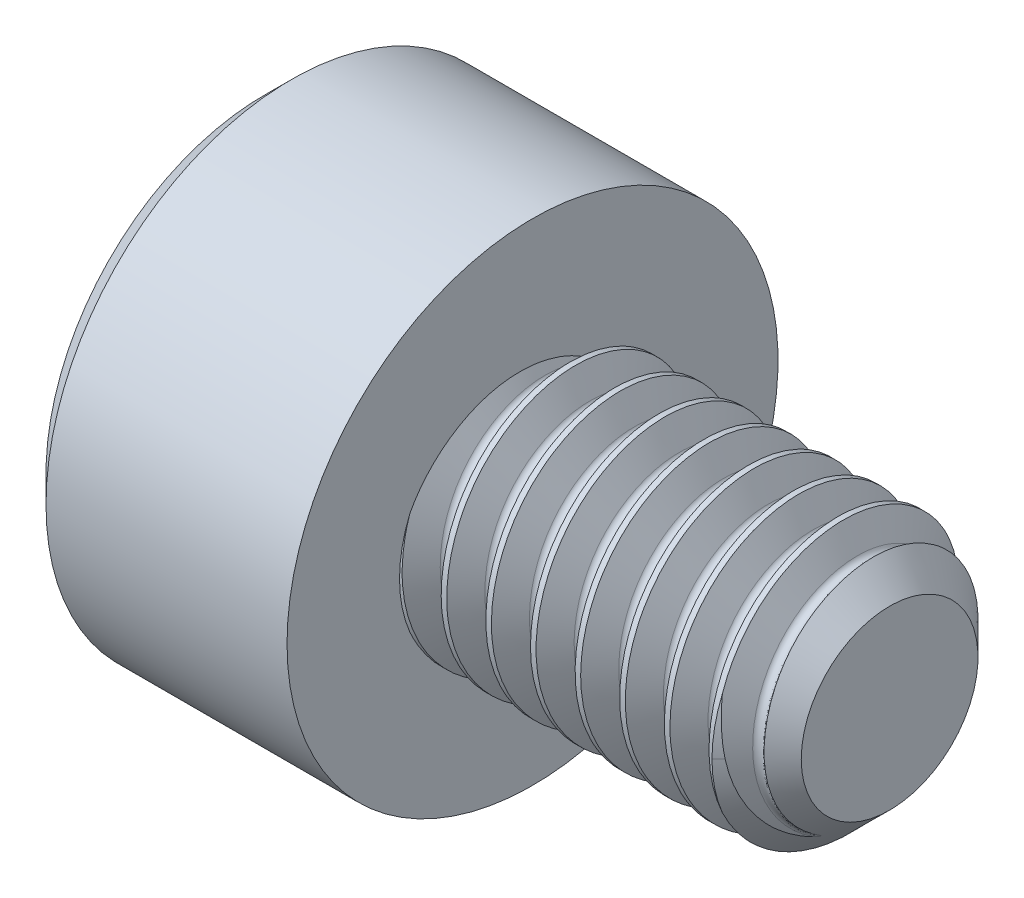
from build123d import *

# Parameters (mm, degrees)
CHAMFER1_SIZE      = 0.5
CHAMFER2_SIZE      = 0.3
CUT_EXTRUDE1_DEPTH = 2.5
CHAMFER3_SIZE      = 0.3
CUT_SWEEP1_PITCH   = 0.5
CUT_SWEEP1_TO      = 4


with BuildPart() as part:
    # Sketch1 → Revolve1 (revolve)
    with BuildSketch(Plane.XY, mode=Mode.PRIVATE) as revolve1_sk:
        Polygon((0, 0), (0, 2.75), (3, 2.75), (3, 1.49), (7, 1.49), (7, 0), align=None)
    revolve(revolve1_sk.sketch.rotate(Axis((-88.705490849, 0, 0), (1, 0, 0)), 90), axis=Axis((-88.705490849, 0, 0), (1, 0, 0)))

    # Chamfer1
    chamfer1_edges = [part.edges().sort_by_distance(p)[0] for p in [
        (7, 0, -1.49),
    ]]
    chamfer(chamfer1_edges, length=CHAMFER1_SIZE)

    # Chamfer2
    chamfer2_edges = [part.edges().sort_by_distance(p)[0] for p in [
        (0, 0, -2.75),
    ]]
    chamfer(chamfer2_edges, length=CHAMFER2_SIZE)

    # Sketch3 → Cut-Extrude1 (cut)
    with BuildSketch(Plane(origin=(0, 0, 0), x_dir=(0, 0, -1), z_dir=(1, 0, 0))):
        Polygon((-1.443375673, 0), (-0.721687836, -1.25), (0.721687836, -1.25), (1.443375673, 0), (0.721687836, 1.25), (-0.721687836, 1.25), align=None)
    extrude(amount=CUT_EXTRUDE1_DEPTH, mode=Mode.SUBTRACT)

    # Chamfer3
    chamfer3_edges = [part.edges().sort_by_distance(p)[0] for p in [
        (0, 0.625, 1.082531755),
        (0, -0.625, 1.082531755),
        (0, -1.25, 0),
        (0, -0.625, -1.082531755),
        (0, 0.625, -1.082531755),
        (0, 1.25, 0),
    ]]
    chamfer(chamfer3_edges, length=CHAMFER3_SIZE)

    # Cut-Sweep1: arcs per turn and ends read off the stored shape
    # Cut-Sweep1: the profile of Sketch8 screwed along a right-hand helix through 9 turns, 6 arcs to a turn; built about Z, then put on its axis
    cut_sweep1_z = Axis((0, 0, 0), (0, 0, 1))
    cut_sweep1_corners = [(1.219375, 0, -0.062498167), (1.6794375, 0, -0.328115375), (1.6794375, 0, 0.328115375), (1.219375, 0, 0.062498167), (1.183291667, 0, 0)]
    with BuildLine(mode=Mode.PRIVATE) as cut_sweep1_profile:
        Line(cut_sweep1_corners[0], cut_sweep1_corners[1])
        Line(cut_sweep1_corners[1], cut_sweep1_corners[2])
        Line(cut_sweep1_corners[2], cut_sweep1_corners[3])
        ThreePointArc((1.219375, 0, 0.062498167), (1.192960167, 0, 0.036083333), (1.183291667, 0, 0))
        ThreePointArc((1.183291667, 0, 0), (1.192960167, 0, -0.036083333), (1.219375, 0, -0.062498167))
    cut_sweep1_cap = Face(cut_sweep1_profile.wire())
    cut_sweep1_arcs = [((1.219375, 0, 0.062498167), (1.183291667, 0, 0.041665444), (1.183291667, 0, 0), (1, 0.8660254037844379, 1)), ((1.183291667, 0, 0), (1.183291667, 0, -0.041665444), (1.219375, 0, -0.062498167), (1, 0.8660254037844379, 1))]  # start, shoulder, end, weights
    cut_sweep1_turn_angles = [0, 30, 60, 90, 120, 150, 180, 210, 240, 270, 300, 330, 360]
    cut_sweep1_turn_weights = [1, 0.8660254037844387, 1, 0.8660254037844387, 1, 0.8660254037844387, 1, 0.8660254037844387, 1, 0.8660254037844387, 1, 0.8660254037844387, 1]
    cut_sweep1_turn_rails = [Edge.make_bspline([Vector(p[0], p[1], 0).rotate(cut_sweep1_z, cut_sweep1_turn_angles[k]) / cut_sweep1_turn_weights[k] + Vector(0, 0, p[2] + CUT_SWEEP1_PITCH * cut_sweep1_turn_angles[k] / 360) for k in range(13)], [0, 0, 0, 1, 1, 2, 2, 3, 3, 4, 4, 5, 5, 6, 6, 6], 2, cut_sweep1_turn_weights) for p in cut_sweep1_corners]
    cut_sweep1_turn_sides = [*[Face.make_surface_from_curves(cut_sweep1_turn_rails[p[0]], cut_sweep1_turn_rails[p[1]]) for p in [(0, 1), (1, 2), (2, 3)]], *[Face.make_bezier_surface([[Vector(p[j][0], p[j][1], 0).rotate(cut_sweep1_z, cut_sweep1_turn_angles[2 * i + k]) / cut_sweep1_turn_weights[2 * i + k] + Vector(0, 0, p[j][2] + CUT_SWEEP1_PITCH * cut_sweep1_turn_angles[2 * i + k] / 360) for k in range(3)] for j in range(3)], [[p[3][j] * cut_sweep1_turn_weights[2 * i + k] for k in range(3)] for j in range(3)]) for p in cut_sweep1_arcs for i in range(6)]]
    cut_sweep1_turn = Solid(Shell([*cut_sweep1_turn_sides, cut_sweep1_cap, cut_sweep1_cap.rotate(cut_sweep1_z, 360).moved(Location((0, 0, CUT_SWEEP1_PITCH * 360 / 360)))]))
    cut_sweep1_each = [*[cut_sweep1_turn.moved(Location((0, 0, CUT_SWEEP1_PITCH * i))) for i in range(9)]]
    add(Plane(origin=(7, 0, 0), x_dir=(0, 0, -1), z_dir=(-1, 0, 0)) * split(Compound([cut_sweep1_each[i] for i in range(0, 9, 2)]), bisect_by=Plane.XY.offset(CUT_SWEEP1_TO), keep=Keep.BOTTOM, mode=Mode.PRIVATE), mode=Mode.SUBTRACT)
    add(Plane(origin=(7, 0, 0), x_dir=(0, 0, -1), z_dir=(-1, 0, 0)) * split(Compound([cut_sweep1_each[i] for i in range(1, 9, 2)]), bisect_by=Plane.XY.offset(CUT_SWEEP1_TO), keep=Keep.BOTTOM, mode=Mode.PRIVATE), mode=Mode.SUBTRACT)


solid = part.part
